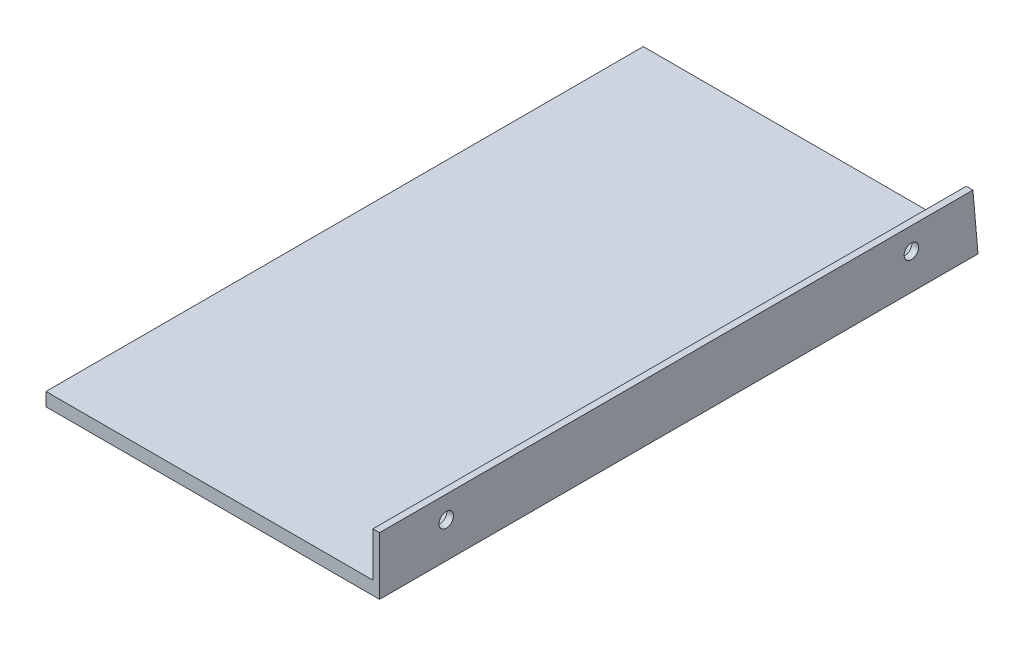
from build123d import *

# Parameters (mm, degrees)
SKETCH1_W           = 134.58
SKETCH1_H           = 3
BOSS_EXTRUDE1_DEPTH = 75
SKETCH2_W           = 3
SKETCH2_H           = 35
BOSS_EXTRUDE2_DEPTH = 9
SKETCH3_R           = 1.575
CUT_EXTRUDE1_DEPTH  = 155.330089095
SKETCH4_W           = 1.5
SKETCH4_H           = 134.58
BOSS_EXTRUDE3_DEPTH = 10
SKETCH6_R           = 1.625
CUT_EXTRUDE2_DEPTH  = 155.614929421


with BuildPart() as part:
    # Sketch1 → Boss-Extrude1 (new body)
    with BuildSketch(Plane(origin=(0, 0, 0), x_dir=(0, 0, -1), z_dir=(1, 0, 0))):
        with Locations((67.29, 1.5)):
            Rectangle(SKETCH1_W, SKETCH1_H)
    extrude(amount=BOSS_EXTRUDE1_DEPTH)

    # Sketch2 → Boss-Extrude2 (add)
    with BuildSketch(Plane.XZ):
        with Locations((1.5, -29.6)):
            Rectangle(SKETCH2_W, SKETCH2_H)
    extrude(amount=BOSS_EXTRUDE2_DEPTH)

    # Sketch3 → Cut-Extrude1 (cut, through all)
    with BuildSketch(Plane.ZY):
        with Locations((-23.766666667, -4.5)):
            Circle(SKETCH3_R)
        with Locations((-35.433333333, -4.5)):
            Circle(SKETCH3_R)
    extrude(amount=-CUT_EXTRUDE1_DEPTH, mode=Mode.SUBTRACT)

    # Sketch4 → Boss-Extrude3 (add)
    with BuildSketch(Plane(origin=(0, 3, 0), x_dir=(1, 0, 0), z_dir=(0, 1, 0))):
        with Locations((74.25, 67.29)):
            Rectangle(SKETCH4_W, SKETCH4_H)
    extrude(amount=BOSS_EXTRUDE3_DEPTH)

    # Sketch6 → Cut-Extrude2 (cut, through all)
    with BuildSketch(Plane(origin=(75, 0, 0), x_dir=(0, 0, -1), z_dir=(1, 0, 0))):
        with Locations((15, 8)):
            Circle(SKETCH6_R)
        with Locations((119.58, 8)):
            Circle(SKETCH6_R)
        Polygon((134.58, 13), (133.42, 13), (134.56, 0), (134.58, 0), align=None)
    extrude(amount=-CUT_EXTRUDE2_DEPTH, mode=Mode.SUBTRACT)


solid = part.part
